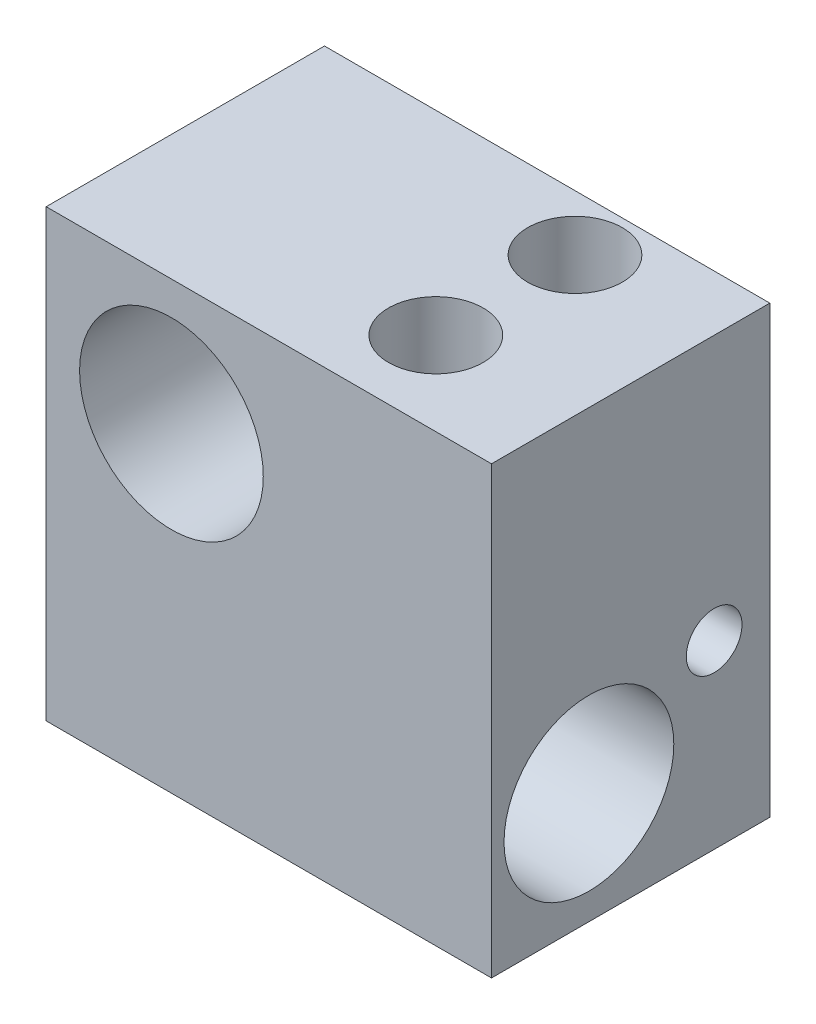
from build123d import *

# Parameters (mm, degrees)
ESQUISSE1_W                     = 16
ESQUISSE1_H                     = 16
BOSS_EXTRU_1_DEPTH              = 10
D_GAGEMENT_M61_D                = 6.6
DIAM_TRE_DU_PER_AGE_6_1_6_1_1_D = 6.1
DIAM_TRE_DU_PER_AGE_2_0_2_1_D   = 2
D_GAGEMENT_M31_D                = 3.4
D_GAGEMENT_M31_DEPTH            = 11
D_GAGEMENT_M31_TIP              = 1.021463052
D_GAGEMENT_M32_D                = 3.4
D_GAGEMENT_M32_DEPTH            = 9
D_GAGEMENT_M32_TIP              = 1.021463052


with BuildPart() as part:
    # Esquisse1 → Boss.-Extru.1 (new body)
    with BuildSketch(Plane.XY):
        with Locations((8, 8)):
            Rectangle(ESQUISSE1_W, ESQUISSE1_H)
    extrude(amount=BOSS_EXTRU_1_DEPTH)

    # Dégagement M61 (through all)
    with Locations(Plane.XY.offset(10)):
        with Locations((4.5, 11.5)):
            Hole(D_GAGEMENT_M61_D / 2)

    # Diamètre du perçage Ø6.1 (6.1)1 (through all)
    with Locations(Plane(origin=(16, 0, 0), x_dir=(0, 0, -1), z_dir=(1, 0, 0))):
        with Locations((-6.5, 4)):
            Hole(DIAM_TRE_DU_PER_AGE_6_1_6_1_1_D / 2)

    # Diamètre du perçage Ø2.0 (2)1 (through all)
    with Locations(Plane(origin=(16, 0, 0), x_dir=(0, 0, -1), z_dir=(1, 0, 0))):
        with Locations((-2, 6.5)):
            Hole(DIAM_TRE_DU_PER_AGE_2_0_2_1_D / 2)

    # Dégagement M31
    with Locations(Plane(origin=(0, 16, 0), x_dir=(1, 0, 0), z_dir=(0, 1, 0))):
        with Locations((11, -7)):
            Hole(D_GAGEMENT_M31_D / 2, depth=D_GAGEMENT_M31_DEPTH)
            with Locations((0, 0, -(D_GAGEMENT_M31_DEPTH + D_GAGEMENT_M31_TIP / 2))):  # 118° drill point
                Cone(0, D_GAGEMENT_M31_D / 2, D_GAGEMENT_M31_TIP, mode=Mode.SUBTRACT)

    # Dégagement M32
    with Locations(Plane(origin=(0, 16, 0), x_dir=(1, 0, 0), z_dir=(0, 1, 0))):
        with Locations((11, -2)):
            Hole(D_GAGEMENT_M32_D / 2, depth=D_GAGEMENT_M32_DEPTH)
            with Locations((0, 0, -(D_GAGEMENT_M32_DEPTH + D_GAGEMENT_M32_TIP / 2))):  # 118° drill point
                Cone(0, D_GAGEMENT_M32_D / 2, D_GAGEMENT_M32_TIP, mode=Mode.SUBTRACT)


solid = part.part
